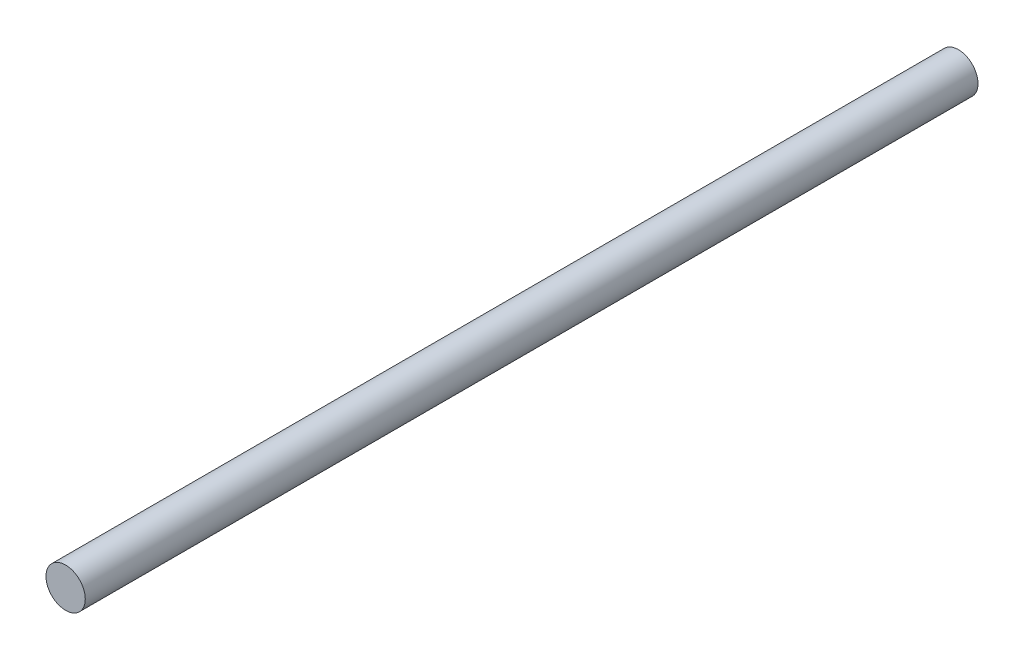
from build123d import *

# Parameters (mm, degrees)
SKETCH1_R           = 1.984375
BOSS_EXTRUDE1_DEPTH = 90.12532


with BuildPart() as part:
    # Sketch1 → Boss-Extrude1 (new body)
    with BuildSketch(Plane.XY):
        Circle(SKETCH1_R)
    extrude(amount=BOSS_EXTRUDE1_DEPTH)


solid = part.part
